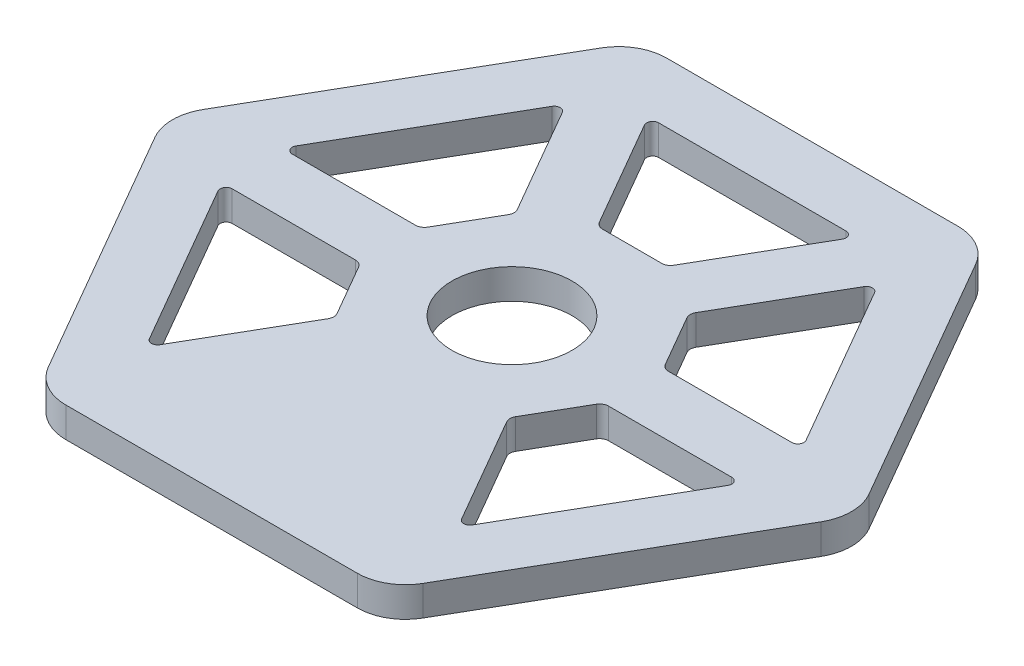
from build123d import *

# Parameters (mm, degrees)
BOSS_EXTRUDE1_DEPTH = 5
FILLET1_R           = 8
SKETCH2_R           = 10
CUT_EXTRUDE1_DEPTH  = 10


with BuildPart() as part:
    # Sketch1 → Boss-Extrude1 (new body)
    with BuildSketch(Plane(origin=(0, 0, 0), x_dir=(1, 0, 0), z_dir=(0, 1, 0))):
        Polygon((-57.735026919, 0), (-28.867513459, -50), (28.867513459, -50), (57.735026919, 0), (28.867513459, 50), (-28.867513459, 50), align=None)
    extrude(amount=BOSS_EXTRUDE1_DEPTH)

    # Fillet1
    fillet1_edges = [part.edges().sort_by_distance(p)[0] for p in [
        (28.867513459, 2.5, -50),
        (57.735026919, 2.5, 0),
        (28.867513459, 2.5, 50),
        (-28.867513459, 2.5, 50),
        (-57.735026919, 2.5, 0),
        (-28.867513459, 2.5, -50),
    ]]
    fillet(fillet1_edges, radius=FILLET1_R)

    # Sketch2 → Cut-Extrude1 (cut)
    with BuildSketch(Plane(origin=(0, 5, 0), x_dir=(1, 0, 0), z_dir=(0, 1, 0))):
        Circle(SKETCH2_R)
        with BuildLine():
            Line((6.206515394, 20.75), (16.454482672, 38.5))
            ThreePointArc((16.454482672, 38.5), (16.454482672, 39.5), (15.588457268, 40))
            Line((15.588457268, 40), (-15.588457268, 40))
            ThreePointArc((-15.588457268, 40), (-16.454482672, 39.5), (-16.454482672, 38.5))
            Line((-16.454482672, 38.5), (-6.206515394, 20.75))
            ThreePointArc((-6.206515394, 20.75), (-5.657477288, 20.200961894), (-4.907477288, 20))
            Line((-4.907477288, 20), (4.907477288, 20))
            ThreePointArc((4.907477288, 20), (5.657477288, 20.200961894), (6.206515394, 20.75))
        make_face()
        with BuildLine():
            Line((21.073284825, 5), (41.569219382, 5))
            ThreePointArc((41.569219382, 5), (42.435244785, 5.5), (42.435244785, 6.5))
            Line((42.435244785, 6.5), (26.846787517, 33.5))
            ThreePointArc((26.846787517, 33.5), (25.980762114, 34), (25.11473671, 33.5))
            Line((25.11473671, 33.5), (14.866769432, 15.75))
            ThreePointArc((14.866769432, 15.75), (14.665807537, 15), (14.866769432, 14.25))
            Line((14.866769432, 14.25), (19.77424672, 5.75))
            ThreePointArc((19.77424672, 5.75), (20.323284825, 5.200961894), (21.073284825, 5))
        make_face()
        with BuildLine():
            Line((14.866769432, -15.75), (25.11473671, -33.5))
            ThreePointArc((25.11473671, -33.5), (25.980762114, -34), (26.846787517, -33.5))
            Line((26.846787517, -33.5), (42.435244785, -6.5))
            ThreePointArc((42.435244785, -6.5), (42.435244785, -5.5), (41.569219382, -5))
            Line((41.569219382, -5), (21.073284825, -5))
            ThreePointArc((21.073284825, -5), (20.323284825, -5.200961894), (19.77424672, -5.75))
            Line((19.77424672, -5.75), (14.866769432, -14.25))
            ThreePointArc((14.866769432, -14.25), (14.665807537, -15), (14.866769432, -15.75))
        make_face()
        with BuildLine():
            Line((-21.073284825, -5), (-41.569219382, -5))
            ThreePointArc((-41.569219382, -5), (-42.435244785, -5.5), (-42.435244785, -6.5))
            Line((-42.435244785, -6.5), (-26.846787517, -33.5))
            ThreePointArc((-26.846787517, -33.5), (-25.980762114, -34), (-25.11473671, -33.5))
            Line((-25.11473671, -33.5), (-14.866769432, -15.75))
            ThreePointArc((-14.866769432, -15.75), (-14.665807537, -15), (-14.866769432, -14.25))
            Line((-14.866769432, -14.25), (-19.77424672, -5.75))
            ThreePointArc((-19.77424672, -5.75), (-20.323284825, -5.200961894), (-21.073284825, -5))
        make_face()
        with BuildLine():
            Line((-14.866769432, 15.75), (-25.11473671, 33.5))
            ThreePointArc((-25.11473671, 33.5), (-25.980762114, 34), (-26.846787517, 33.5))
            Line((-26.846787517, 33.5), (-42.435244785, 6.5))
            ThreePointArc((-42.435244785, 6.5), (-42.435244785, 5.5), (-41.569219382, 5))
            Line((-41.569219382, 5), (-21.073284825, 5))
            ThreePointArc((-21.073284825, 5), (-20.323284825, 5.200961894), (-19.77424672, 5.75))
            Line((-19.77424672, 5.75), (-14.866769432, 14.25))
            ThreePointArc((-14.866769432, 14.25), (-14.665807537, 15), (-14.866769432, 15.75))
        make_face()
    extrude(amount=-CUT_EXTRUDE1_DEPTH, mode=Mode.SUBTRACT)


solid = part.part
